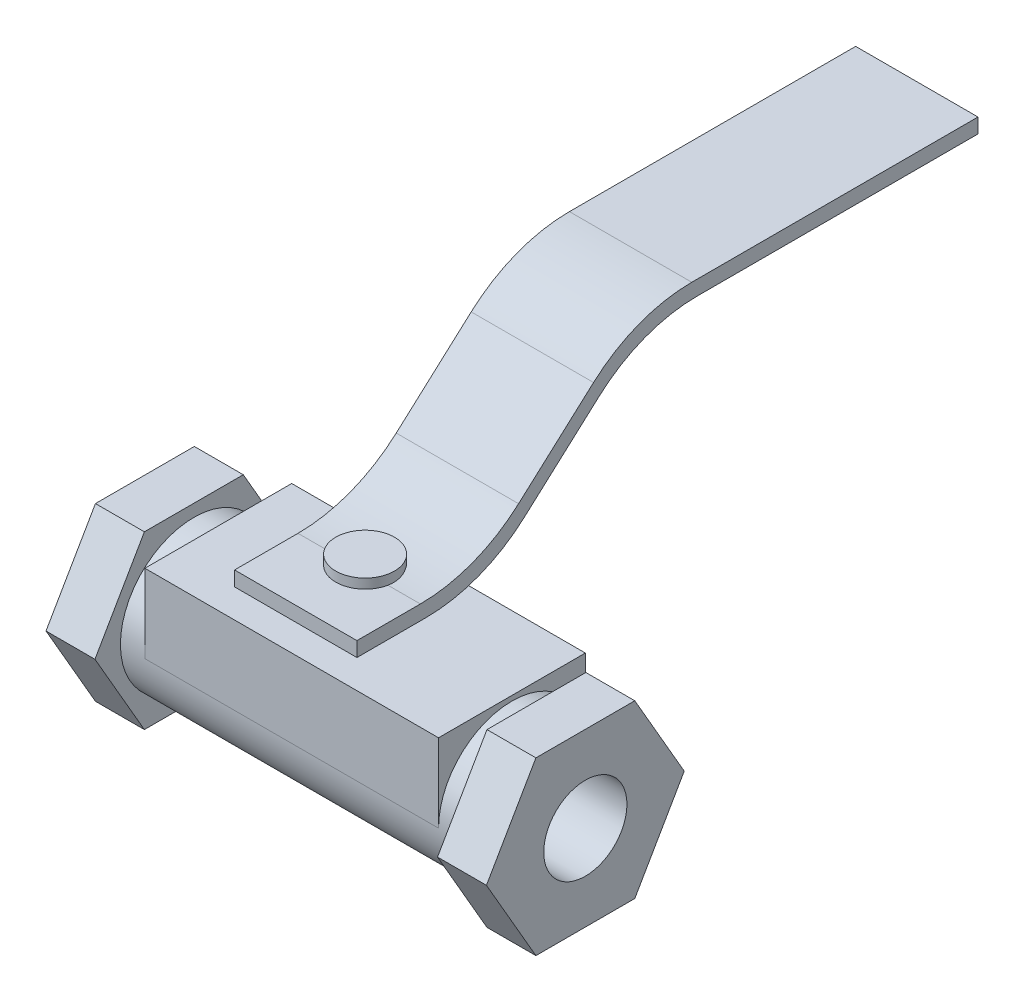
from build123d import *

# Parameters (mm, degrees)
SKETCH1_R               = 15
SKETCH1_R_2             = 5
EXTRUDE_THIN1_DEPTH     = 45
SKETCH2_W               = 60
SKETCH2_H               = 30
BOSS_EXTRUDE1_DEPTH     = 16
SKETCH3_R               = 6
BOSS_EXTRUDE2_DEPTH     = 10
EXTRUDE_THIN2_DEPTH     = 12.5
FILLET1_R               = 30
BOSS_EXTRUDE3_DEPTH     = 10
CUT_EXTRUDE1_DEPTH      = 133.543633763
CUT_EXTRUDE1_DEPTH_BACK = 133.543633763
SKETCH6_R               = 8.5


with BuildPart() as part:
    # Sketch1 → Extrude-Thin1 (new, symmetric)
    with BuildSketch(Plane(origin=(0, 0, 0), x_dir=(0, 0, -1), z_dir=(1, 0, 0))):
        Circle(SKETCH1_R)
        Circle(SKETCH1_R_2, mode=Mode.SUBTRACT)
    extrude(amount=EXTRUDE_THIN1_DEPTH, both=True)

    # Sketch2 → Boss-Extrude1 (add)
    with BuildSketch(Plane(origin=(0, 0, 0), x_dir=(1, 0, 0), z_dir=(0, 1, 0))):
        Rectangle(SKETCH2_W, SKETCH2_H)
    extrude(amount=BOSS_EXTRUDE1_DEPTH)

    # Sketch3 → Boss-Extrude2 (add)
    with BuildSketch(Plane(origin=(0, 16, 0), x_dir=(1, 0, 0), z_dir=(0, 1, 0))):
        with Locations(Location((0, 0, 0), (0, 0, 270))):
            Circle(SKETCH3_R)
    extrude(amount=BOSS_EXTRUDE2_DEPTH)

    # Sketch4 → Extrude-Thin2 (add, symmetric)
    with BuildSketch(Plane(origin=(0, 0, 0), x_dir=(0, 0, -1), z_dir=(1, 0, 0))):
        Polygon((-14.175668382, 24.036944014), (10.301514998, 24.036944014), (42.733043078, 53.23603901), (112.733043078, 53.23603901), (112.733043078, 50.23603901), (43.884565313, 50.23603901), (11.453037232, 21.036944014), (-14.175668382, 21.036944014), align=None)
    extrude(amount=EXTRUDE_THIN2_DEPTH, both=True)

    # Fillet1
    # the kernel refuses this fillet: 30 mm, written as the material it adds along each edge
    with BuildSketch(Plane(origin=(12.5, 50.23603901, -43.884565313), x_dir=(0, -0.6691004351822666, 0.7431719906178524), z_dir=(-1, 0, 0))) as fillet1_piece_1:
        with BuildLine():
            CenterArc((FILLET1_R * 0.383840744794, -FILLET1_R), FILLET1_R, 90, 41.997673873)
            Line((-FILLET1_R * 0.285259690389, -FILLET1_R * 0.256828009382), (0, 0))
            Line((0, 0), (FILLET1_R * 0.383840744794, 0))
        make_face()
    extrude(amount=25)
    with BuildSketch(Plane(origin=(12.5, 24.036944014, -10.301514998), x_dir=(0, 0, 1), z_dir=(-1, 0, 0))) as fillet1_piece_2:
        with BuildLine():
            CenterArc((FILLET1_R * 0.383840744794, FILLET1_R), FILLET1_R, 228.002326127, 41.997673873)
            Line((-FILLET1_R * 0.285259690389, FILLET1_R * 0.256828009382), (0, 0))
            Line((0, 0), (FILLET1_R * 0.383840744794, 0))
        make_face()
    extrude(amount=25)
    # the kernel refuses this fillet: 30 mm, written as the material it takes off along each edge
    with BuildSketch(Plane(origin=(41.28805586, 53.23603901, -42.733043078), x_dir=(0, -0.6691004351822663, 0.7431719906178528), z_dir=(-1, 0, 0))) as fillet1_2_piece_1:
        with BuildLine():
            CenterArc((FILLET1_R * 0.383840744794, -FILLET1_R), FILLET1_R, 90, 41.997673873)
            Line((-FILLET1_R * 0.285259690389, -FILLET1_R * 0.256828009382), (0, 0))
            Line((0, 0), (FILLET1_R * 0.383840744794, 0))
        make_face()
    extrude(amount=82.576111719, mode=Mode.SUBTRACT)
    with BuildSketch(Plane(origin=(-41.28805586, 21.036944014, -11.453037232), x_dir=(0, 0, 1), z_dir=(1, 0, 0))) as fillet1_2_piece_2_section:
        with BuildLine():
            CenterArc((FILLET1_R * 0.383840744794, -FILLET1_R), FILLET1_R, 90, 41.997673873)
            Line((-FILLET1_R * 0.285259690389, -FILLET1_R * 0.256828009382), (0, 0))
            Line((0, 0), (FILLET1_R * 0.383840744794, 0))
        make_face()
    fillet1_2_piece_2 = extrude(amount=82.576111719, mode=Mode.PRIVATE)
    fillet1_2_piece_2 = fillet1_2_piece_2 - Plane(origin=(0, 22.678661346, 0), x_dir=(0, 0, 1), z_dir=(0, -1, 0)) * Cylinder(6, 212, mode=Mode.PRIVATE)
    add(fillet1_2_piece_2, mode=Mode.SUBTRACT)

    # Sketch5 → Boss-Extrude3 (add)
    with BuildSketch(Plane(origin=(45, 0, 0), x_dir=(0, 0, -1), z_dir=(1, 0, 0))):
        Polygon((-20.207259422, 0), (-10.103629711, -17.5), (10.103629711, -17.5), (20.207259422, 0), (10.103629711, 17.5), (-10.103629711, 17.5), align=None)
    boss_extrude3 = extrude(amount=-BOSS_EXTRUDE3_DEPTH)

    # Mirror1: Boss-Extrude3 across plane
    add(boss_extrude3.mirror(Plane(origin=(0, 0, 0), x_dir=(0, 0, 1), z_dir=(1, 0, 0))))

    # Sketch6 → Cut-Extrude1 (cut, two sides: drawn at the far end of the back side and taken through both)
    with BuildSketch(Plane(origin=(0, 0, 0), x_dir=(0, 0, -1), z_dir=(1, 0, 0)).offset(-CUT_EXTRUDE1_DEPTH_BACK)):
        Circle(SKETCH6_R)
    extrude(amount=CUT_EXTRUDE1_DEPTH + CUT_EXTRUDE1_DEPTH_BACK, mode=Mode.SUBTRACT)


solid = part.part
